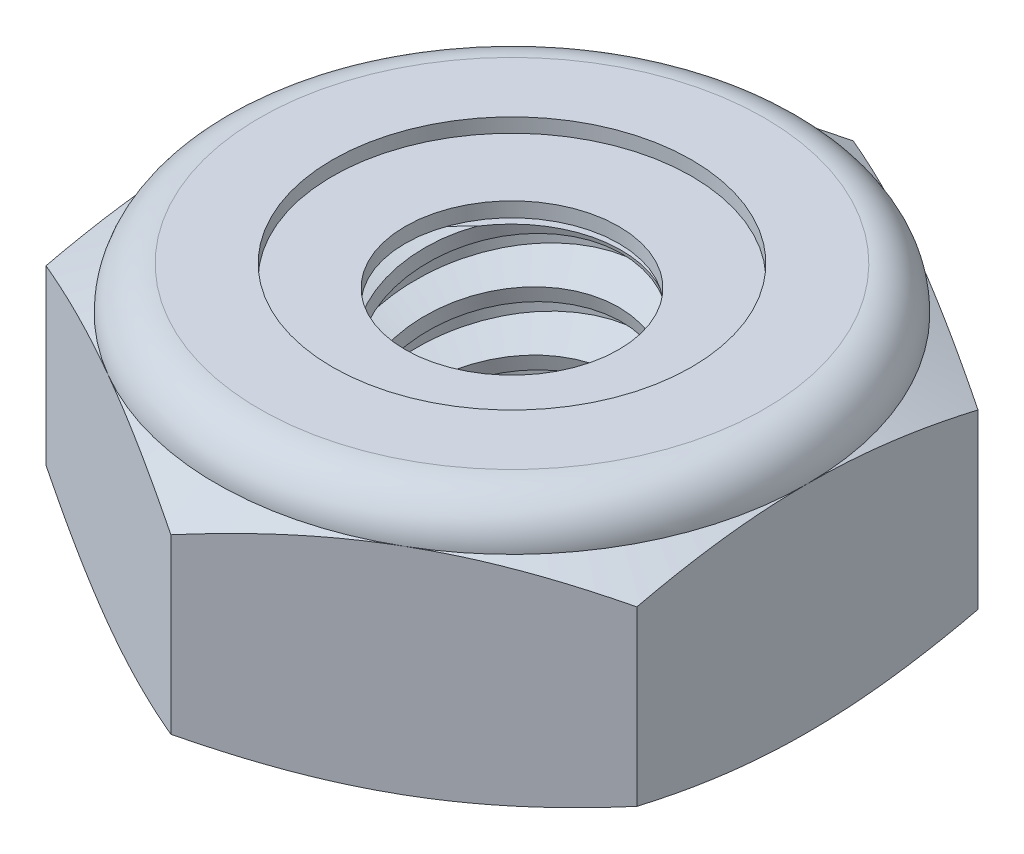
from build123d import *

# Parameters (mm, degrees)
EXTRUDE1_DEPTH       = 2.778125
SKETCH2_W            = 1.4224
SKETCH2_H            = 2.778125
LPATTERN1_COUNT      = 4
LPATTERN1_PITCH      = 0.635
LPATTERN1_COUNT_DIR2 = 2
LPATTERN1_PITCH_DIR2 = 0.635


with BuildPart() as part:
    # Sketch1 → Extrude1 (new body)
    with BuildSketch(Plane(origin=(0, 0, 0), x_dir=(1, 0, 0), z_dir=(0, 1, 0))):
        Polygon((0, 3.666174209), (-3.175, 1.833087105), (-3.175, -1.833087105), (0, -3.666174209), (3.175, -1.833087105), (3.175, 1.833087105), align=None)
    extrude(amount=EXTRUDE1_DEPTH)

    # Sketch4 → Cut-Revolve2 (revolve, cut)
    with BuildSketch(Plane(origin=(0, 0, 0), x_dir=(0, 0, -1), z_dir=(1, 0, 0))):
        Polygon((0, 2.778125), (1.4224, 2.778125), (1.147473684, 2.649924754), (1.147473684, 0.128200246), (1.4224, 0), (0, 0), align=None)
    revolve(axis=Axis((0, 2.778125, 0), (0, 1, 0)), mode=Mode.SUBTRACT)


with BuildPart() as body_2:
    # Sketch2 → Revolve1 (revolve)
    with BuildSketch(Plane(origin=(0, 0, 0), x_dir=(0, 0, -1), z_dir=(1, 0, 0))):
        with Locations((0.7112, 1.3890625)):
            Rectangle(SKETCH2_W, SKETCH2_H)
    revolve(axis=Axis((0, -1.4224, 0), (0, 1, 0)))

    # Sketch3 → Cut-Revolve1 (revolve, cut)
    with BuildSketch(Plane(origin=(0, 0, 0), x_dir=(0, 0, -1), z_dir=(1, 0, 0))):
        Polygon((1.439692084, 2.700656462), (1.560736676, 2.158376693), (1.182057853, 2.277171117), (1.147473684, 2.432108194), align=None)
    cut_revolve1 = revolve(axis=Axis((0, 2.778125, 0.152561988), (0, -0.9759815859905214, -0.21785303258717015)), mode=Mode.SUBTRACT)

    # LPattern1: Cut-Revolve1 4 × 2
    with Locations(*[Vector(0, -1, 0) * (i * LPATTERN1_PITCH) + Vector(0, 1, 0) * (j * LPATTERN1_PITCH_DIR2) for i in range(LPATTERN1_COUNT) for j in range(LPATTERN1_COUNT_DIR2) if (i, j) != (0, 0)]):
        add(cut_revolve1, mode=Mode.SUBTRACT)


with BuildPart() as part_1:
    add(part.part)

    # Combine1: cut body 2
    add(body_2.part, mode=Mode.SUBTRACT)

    # Sketch5 → Cut-Revolve3 (revolve, cut)
    with BuildSketch(Plane(origin=(0, 0, 0), x_dir=(0, 0, -1), z_dir=(1, 0, 0))):
        with BuildLine():
            Line((0, 0), (3.175, 0))
            Line((3.175, 0), (3.666174209, 0.229038295))
            Line((3.666174209, 0.229038295), (3.666174209, 2.086065871))
            Line((3.666174209, 2.086065871), (3.175, 2.315104167))
            ThreePointArc((3.175, 2.315104167), (3.039384338, 2.642509338), (2.711979167, 2.778125))
            Line((2.711979167, 2.778125), (2.711979167, 4.048125))
            Line((2.711979167, 4.048125), (4.936174209, 4.048125))
            Line((4.936174209, 4.048125), (4.936174209, -1.27))
            Line((4.936174209, -1.27), (0, -1.27))
            Line((0, -1.27), (0, 0))
        make_face()
    revolve(axis=Axis((0, 0, 0), (0, 1, 0)), mode=Mode.SUBTRACT)

    # Sketch6 → Cut-Revolve4 (revolve, cut)
    with BuildSketch(Plane(origin=(0, 0, 0), x_dir=(0, 0, -1), z_dir=(1, 0, 0))):
        with BuildLine():
            Line((0, 2.315104167), (3.0226, 2.315104167))
            ThreePointArc((3.0226, 2.315104167), (2.931621264, 2.534746264), (2.711979167, 2.625725))
            Line((2.711979167, 2.625725), (1.929726426, 2.625725))
            Line((1.929726426, 2.625725), (1.929726426, 4.048125))
            Line((1.929726426, 4.048125), (0, 4.048125))
            Line((0, 4.048125), (0, 2.315104167))
        make_face()
    revolve(axis=Axis((0, 4.048125, 0), (0, 1, 0)), mode=Mode.SUBTRACT)


with BuildPart() as body_2_2:
    # Sketch7 → Revolve2 (revolve)
    with BuildSketch(Plane(origin=(0, 0, 0), x_dir=(0, 0, -1), z_dir=(1, 0, 0))):
        with BuildLine():
            Line((1.147473684, 2.391304167), (2.933669688, 2.391304167))
            ThreePointArc((2.933669688, 2.391304167), (2.848159671, 2.505912964), (2.711979167, 2.549525))
            Line((2.711979167, 2.549525), (1.147473684, 2.549525))
            Line((1.147473684, 2.549525), (1.147473684, 2.391304167))
        make_face()
    revolve(axis=Axis((0, 2.391304167, 0), (0, 1, 0)))


solid = Compound([part_1.part, body_2_2.part])
